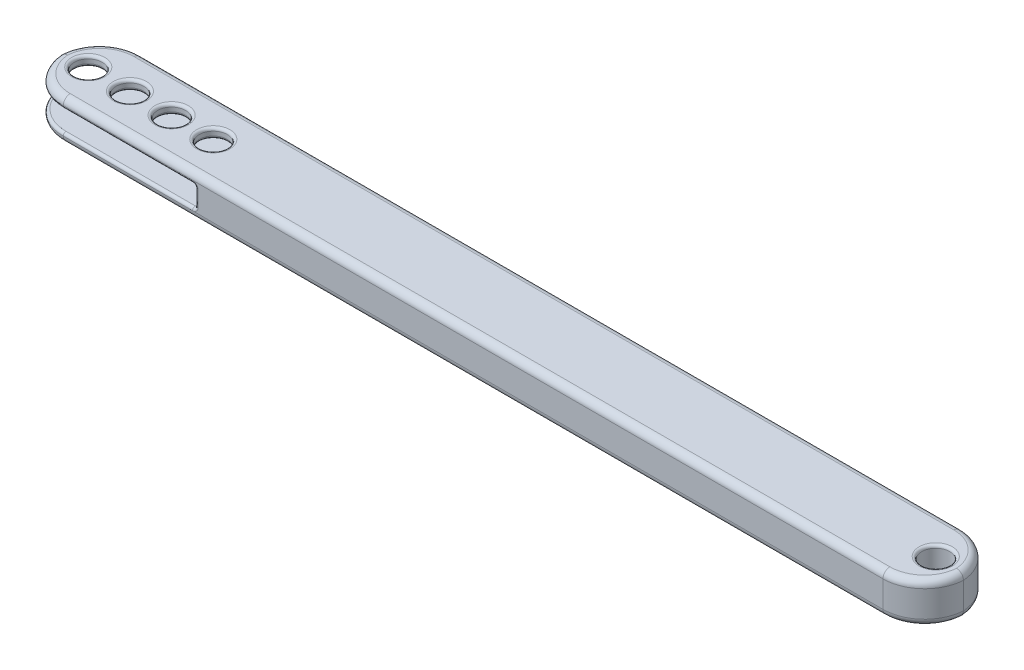
from build123d import *

# Parameters (mm, degrees)
SKETCH1_W           = 130
SKETCH1_H           = 11.2
BOSS_EXTRUDE1_DEPTH = 5.8
SKETCH2_R           = 2
CUT_EXTRUDE1_DEPTH  = 131.610413061
FILLET1_R           = 6
FILLET2_R           = 1
SKETCH3_W           = 25
SKETCH3_H           = 3
CUT_EXTRUDE2_DEPTH  = 131.597127382
FILLET3_R           = 0.4


with BuildPart() as part:
    # Sketch1 → Boss-Extrude1 (new body)
    with BuildSketch(Plane(origin=(0, 0, 0), x_dir=(1, 0, 0), z_dir=(0, 1, 0))):
        with Locations((65, 5.6)):
            Rectangle(SKETCH1_W, SKETCH1_H)
    extrude(amount=BOSS_EXTRUDE1_DEPTH)

    # Sketch2 → Cut-Extrude1 (cut, through all)
    with BuildSketch(Plane(origin=(0, 5.8, 0), x_dir=(1, 0, 0), z_dir=(0, 1, 0))):
        with Locations(Location((4, 5.6, 0), (0, 0, 270))):
            Circle(SKETCH2_R)
        with Locations(Location((126, 5.6, 0), (0, 0, 270))):
            Circle(SKETCH2_R)
        with Locations(Location((10, 5.6, 0), (0, 0, 270))):
            Circle(SKETCH2_R)
        with Locations(Location((16, 5.6, 0), (0, 0, 270))):
            Circle(SKETCH2_R)
        with Locations(Location((22, 5.6, 0), (0, 0, 270))):
            Circle(SKETCH2_R)
    extrude(amount=-CUT_EXTRUDE1_DEPTH, mode=Mode.SUBTRACT)

    # Fillet1
    # the kernel refuses this fillet: 6 mm, written as the material it takes off along each edge
    with BuildSketch(Plane(origin=(130, -15, 0), x_dir=(-1, 0, 0), z_dir=(0, 1, 0)), Plane(origin=(130, -15, -11.2), x_dir=(0, 0, 1), z_dir=(0, 1, 0))) as fillet1_piece_1:
        with BuildLine():
            CenterArc((FILLET1_R, -FILLET1_R), FILLET1_R, 90, 90)
            Line((0, -FILLET1_R), (0, 0))
            Line((0, 0), (FILLET1_R, 0))
        make_face()
    extrude(amount=35.8, mode=Mode.SUBTRACT)
    with BuildSketch(Plane(origin=(0, -15, -11.2), x_dir=(0, 0, 1), z_dir=(0, 1, 0)), Plane(origin=(0, -15, 0), x_dir=(1, 0, 0), z_dir=(0, 1, 0))) as fillet1_piece_2:
        with BuildLine():
            CenterArc((FILLET1_R, FILLET1_R), FILLET1_R, 180, 90)
            Line((0, FILLET1_R), (0, 0))
            Line((0, 0), (FILLET1_R, 0))
        make_face()
    extrude(amount=35.8, mode=Mode.SUBTRACT)

    # Fillet2
    # the kernel refuses this fillet: 1 mm, written as the material it takes off along each edge
    with BuildSketch(Plane(origin=(124, 0, -11.2), x_dir=(0, 0, 1), z_dir=(-1, 0, 0)), Plane(origin=(6, 5.8, 0), x_dir=(0, -1, 0), z_dir=(1, 0, 0))) as fillet2_piece_1:
        with BuildLine():
            CenterArc((FILLET2_R, FILLET2_R), FILLET2_R, 180, 90)
            Line((0, FILLET2_R), (0, 0))
            Line((0, 0), (FILLET2_R, 0))
        make_face()
    extrude(amount=118, mode=Mode.SUBTRACT)
    with BuildSketch(Plane(origin=(6, 0, 0), x_dir=(0, 1, 0), z_dir=(1, 0, 0)), Plane(origin=(124, 5.8, -11.2), x_dir=(0, 0, 1), z_dir=(-1, 0, 0))) as fillet2_piece_2:
        with BuildLine():
            CenterArc((FILLET2_R, -FILLET2_R), FILLET2_R, 90, 90)
            Line((0, -FILLET2_R), (0, 0))
            Line((0, 0), (FILLET2_R, 0))
        make_face()
    extrude(amount=118, mode=Mode.SUBTRACT)
    with BuildSketch(Plane(origin=(124, 0, -5.2), x_dir=(0, 0, -1), z_dir=(-1, 0, 0))) as fillet2_piece_3:
        with BuildLine():
            CenterArc((6 - FILLET2_R, -FILLET2_R), FILLET2_R, 0, 90)
            Line((6, -FILLET2_R), (6, 0))
            Line((6, 0), (6 - FILLET2_R, 0))
        make_face()
    revolve(axis=Axis((124, 0, -5.2), (0, -1, 0)), revolution_arc=110.05948027, mode=Mode.SUBTRACT)
    with BuildSketch(Plane(origin=(124, 0, -6), x_dir=(0.9393370543039211, 0, -0.3429954787043592), z_dir=(-0.3429954787043592, 0, -0.9393370543039211))) as fillet2_piece_4:
        with BuildLine():
            CenterArc((6 - FILLET2_R, -FILLET2_R), FILLET2_R, 0, 90)
            Line((6, -FILLET2_R), (6, 0))
            Line((6, 0), (6 - FILLET2_R, 0))
        make_face()
    revolve(axis=Axis((124, 0, -6), (0, -1, 0)), revolution_arc=110.05948027, mode=Mode.SUBTRACT)
    with BuildSketch(Plane(origin=(6, 0, -6), x_dir=(0, 0, 1), z_dir=(1, 0, 0))) as fillet2_piece_5:
        with BuildLine():
            CenterArc((6 - FILLET2_R, -FILLET2_R), FILLET2_R, 0, 90)
            Line((6, -FILLET2_R), (6, 0))
            Line((6, 0), (6 - FILLET2_R, 0))
        make_face()
    revolve(axis=Axis((6, 0, -6), (0, -1, 0)), revolution_arc=110.05948027, mode=Mode.SUBTRACT)
    with BuildSketch(Plane(origin=(6, 0, -5.2), x_dir=(-0.9393370543039198, 0, 0.3429954787043625), z_dir=(0.3429954787043625, 0, 0.9393370543039198))) as fillet2_piece_6:
        with BuildLine():
            CenterArc((6 - FILLET2_R, -FILLET2_R), FILLET2_R, 0, 90)
            Line((6, -FILLET2_R), (6, 0))
            Line((6, 0), (6 - FILLET2_R, 0))
        make_face()
    revolve(axis=Axis((6, 0, -5.2), (0, -1, 0)), revolution_arc=110.05948027, mode=Mode.SUBTRACT)
    with BuildSketch(Plane(origin=(124, 5.8, -5.2), x_dir=(0, 0, -1), z_dir=(-1, 0, 0))) as fillet2_piece_7:
        with BuildLine():
            CenterArc((6 - FILLET2_R, FILLET2_R), FILLET2_R, 270, 90)
            Line((6, FILLET2_R), (6, 0))
            Line((6, 0), (6 - FILLET2_R, 0))
        make_face()
    revolve(axis=Axis((124, 5.8, -5.2), (0, -1, 0)), revolution_arc=110.05948027, mode=Mode.SUBTRACT)
    with BuildSketch(Plane(origin=(124, 5.8, -6), x_dir=(0.9393370543039211, 0, -0.3429954787043592), z_dir=(-0.3429954787043592, 0, -0.9393370543039211))) as fillet2_piece_8:
        with BuildLine():
            CenterArc((6 - FILLET2_R, FILLET2_R), FILLET2_R, 270, 90)
            Line((6 - FILLET2_R, 0), (6, 0))
            Line((6, 0), (6, FILLET2_R))
        make_face()
    revolve(axis=Axis((124, 5.8, -6), (0, -1, 0)), revolution_arc=110.05948027, mode=Mode.SUBTRACT)
    with BuildSketch(Plane(origin=(6, 5.8, -6), x_dir=(0, 0, 1), z_dir=(1, 0, 0))) as fillet2_piece_9:
        with BuildLine():
            CenterArc((6 - FILLET2_R, FILLET2_R), FILLET2_R, 270, 90)
            Line((6, FILLET2_R), (6, 0))
            Line((6, 0), (6 - FILLET2_R, 0))
        make_face()
    revolve(axis=Axis((6, 5.8, -6), (0, -1, 0)), revolution_arc=110.05948027, mode=Mode.SUBTRACT)
    with BuildSketch(Plane(origin=(6, 5.8, -5.2), x_dir=(-0.9393370543039198, 0, 0.3429954787043625), z_dir=(0.3429954787043625, 0, 0.9393370543039198))) as fillet2_piece_10:
        with BuildLine():
            CenterArc((6 - FILLET2_R, FILLET2_R), FILLET2_R, 270, 90)
            Line((6, FILLET2_R), (6, 0))
            Line((6, 0), (6 - FILLET2_R, 0))
        make_face()
    revolve(axis=Axis((6, 5.8, -5.2), (0, -1, 0)), revolution_arc=110.05948027, mode=Mode.SUBTRACT)

    # Sketch3 → Cut-Extrude2 (cut, through all)
    with BuildSketch(Plane(origin=(0, 0, -11.2), x_dir=(-1, 0, 0), z_dir=(0, 0, -1))):
        with Locations((-12.513348181, 2.9)):
            Rectangle(SKETCH3_W, SKETCH3_H)
    extrude(amount=-CUT_EXTRUDE2_DEPTH, mode=Mode.SUBTRACT)

    # Fillet3
    # the kernel refuses this fillet: 0.4 mm, written as the material it adds along each edge
    with BuildSketch(Plane(origin=(25.013348181, 4.4, -11.2), x_dir=(-1, 0, 0), z_dir=(0, 0, 1)), Plane(origin=(25.013348181, 1.4, -11.2), x_dir=(0, 1, 0), z_dir=(0, 0, 1))) as fillet3_piece_1:
        with BuildLine():
            CenterArc((FILLET3_R, FILLET3_R), FILLET3_R, 180, 90)
            Line((0, FILLET3_R), (0, 0))
            Line((0, 0), (FILLET3_R, 0))
        make_face()
    extrude(amount=11.2)
    # the kernel refuses this fillet: 0.4 mm, written as the material it takes off along each edge
    with BuildSketch(Plane(origin=(126, 5.8, -5.6), x_dir=(0, 0, 1), z_dir=(-1, 0, 0))) as fillet3_2_piece_1:
        with BuildLine():
            CenterArc((2 + FILLET3_R, -FILLET3_R), FILLET3_R, 90, 90)
            Line((2, -FILLET3_R), (2, 0))
            Line((2, 0), (2 + FILLET3_R, 0))
        make_face()
    revolve(axis=Axis((126, 5.8, -5.6), (0, 1, 0)), mode=Mode.SUBTRACT)
    with BuildSketch(Plane(origin=(126, 0, -5.6), x_dir=(0, 0, 1), z_dir=(-1, 0, 0))) as fillet3_2_piece_2:
        with BuildLine():
            CenterArc((2 + FILLET3_R, FILLET3_R), FILLET3_R, 180, 90)
            Line((2, FILLET3_R), (2, 0))
            Line((2, 0), (2 + FILLET3_R, 0))
        make_face()
    revolve(axis=Axis((126, 0, -5.6), (0, 1, 0)), mode=Mode.SUBTRACT)
    with BuildSketch(Plane(origin=(4, 5.8, -5.6), x_dir=(0, 0, 1), z_dir=(-1, 0, 0))) as fillet3_2_piece_3:
        with BuildLine():
            CenterArc((2 + FILLET3_R, -FILLET3_R), FILLET3_R, 90, 90)
            Line((2, -FILLET3_R), (2, 0))
            Line((2, 0), (2 + FILLET3_R, 0))
        make_face()
    revolve(axis=Axis((4, 5.8, -5.6), (0, 1, 0)), mode=Mode.SUBTRACT)
    with BuildSketch(Plane(origin=(4, 4.4, -5.6), x_dir=(0, 0, 1), z_dir=(-1, 0, 0))) as fillet3_2_piece_4:
        with BuildLine():
            CenterArc((2 + FILLET3_R, FILLET3_R), FILLET3_R, 180, 90)
            Line((2, FILLET3_R), (2, 0))
            Line((2, 0), (2 + FILLET3_R, 0))
        make_face()
    revolve(axis=Axis((4, 4.4, -5.6), (0, 1, 0)), mode=Mode.SUBTRACT)
    with BuildSketch(Plane(origin=(4, 0, -5.6), x_dir=(0, 0, 1), z_dir=(-1, 0, 0))) as fillet3_2_piece_5:
        with BuildLine():
            CenterArc((2 + FILLET3_R, FILLET3_R), FILLET3_R, 180, 90)
            Line((2, FILLET3_R), (2, 0))
            Line((2, 0), (2 + FILLET3_R, 0))
        make_face()
    revolve(axis=Axis((4, 0, -5.6), (0, 1, 0)), mode=Mode.SUBTRACT)
    with BuildSketch(Plane(origin=(4, 1.4, -5.6), x_dir=(0, 0, 1), z_dir=(-1, 0, 0))) as fillet3_2_piece_6:
        with BuildLine():
            CenterArc((2 + FILLET3_R, -FILLET3_R), FILLET3_R, 90, 90)
            Line((2, -FILLET3_R), (2, 0))
            Line((2, 0), (2 + FILLET3_R, 0))
        make_face()
    revolve(axis=Axis((4, 1.4, -5.6), (0, 1, 0)), mode=Mode.SUBTRACT)
    with BuildSketch(Plane(origin=(22, 0, -5.6), x_dir=(0, 0, 1), z_dir=(-1, 0, 0))) as fillet3_2_piece_7:
        with BuildLine():
            CenterArc((2 + FILLET3_R, FILLET3_R), FILLET3_R, 180, 90)
            Line((2, FILLET3_R), (2, 0))
            Line((2, 0), (2 + FILLET3_R, 0))
        make_face()
    revolve(axis=Axis((22, 0, -5.6), (0, 1, 0)), mode=Mode.SUBTRACT)
    with BuildSketch(Plane(origin=(22, 1.4, -5.6), x_dir=(0, 0, 1), z_dir=(-1, 0, 0))) as fillet3_2_piece_8:
        with BuildLine():
            CenterArc((2 + FILLET3_R, -FILLET3_R), FILLET3_R, 90, 90)
            Line((2, -FILLET3_R), (2, 0))
            Line((2, 0), (2 + FILLET3_R, 0))
        make_face()
    revolve(axis=Axis((22, 1.4, -5.6), (0, 1, 0)), mode=Mode.SUBTRACT)
    with BuildSketch(Plane(origin=(22, 5.8, -5.6), x_dir=(0, 0, 1), z_dir=(-1, 0, 0))) as fillet3_2_piece_9:
        with BuildLine():
            CenterArc((2 + FILLET3_R, -FILLET3_R), FILLET3_R, 90, 90)
            Line((2, -FILLET3_R), (2, 0))
            Line((2, 0), (2 + FILLET3_R, 0))
        make_face()
    revolve(axis=Axis((22, 5.8, -5.6), (0, 1, 0)), mode=Mode.SUBTRACT)
    with BuildSketch(Plane(origin=(22, 4.4, -5.6), x_dir=(0, 0, 1), z_dir=(-1, 0, 0))) as fillet3_2_piece_10:
        with BuildLine():
            CenterArc((2 + FILLET3_R, FILLET3_R), FILLET3_R, 180, 90)
            Line((2, FILLET3_R), (2, 0))
            Line((2, 0), (2 + FILLET3_R, 0))
        make_face()
    revolve(axis=Axis((22, 4.4, -5.6), (0, 1, 0)), mode=Mode.SUBTRACT)
    with BuildSketch(Plane(origin=(16, 0, -5.6), x_dir=(0, 0, 1), z_dir=(-1, 0, 0))) as fillet3_2_piece_11:
        with BuildLine():
            CenterArc((2 + FILLET3_R, FILLET3_R), FILLET3_R, 180, 90)
            Line((2, FILLET3_R), (2, 0))
            Line((2, 0), (2 + FILLET3_R, 0))
        make_face()
    revolve(axis=Axis((16, 0, -5.6), (0, 1, 0)), mode=Mode.SUBTRACT)
    with BuildSketch(Plane(origin=(16, 1.4, -5.6), x_dir=(0, 0, 1), z_dir=(-1, 0, 0))) as fillet3_2_piece_12:
        with BuildLine():
            CenterArc((2 + FILLET3_R, -FILLET3_R), FILLET3_R, 90, 90)
            Line((2, -FILLET3_R), (2, 0))
            Line((2, 0), (2 + FILLET3_R, 0))
        make_face()
    revolve(axis=Axis((16, 1.4, -5.6), (0, 1, 0)), mode=Mode.SUBTRACT)
    with BuildSketch(Plane(origin=(16, 5.8, -5.6), x_dir=(0, 0, 1), z_dir=(-1, 0, 0))) as fillet3_2_piece_13:
        with BuildLine():
            CenterArc((2 + FILLET3_R, -FILLET3_R), FILLET3_R, 90, 90)
            Line((2, -FILLET3_R), (2, 0))
            Line((2, 0), (2 + FILLET3_R, 0))
        make_face()
    revolve(axis=Axis((16, 5.8, -5.6), (0, 1, 0)), mode=Mode.SUBTRACT)
    with BuildSketch(Plane(origin=(16, 4.4, -5.6), x_dir=(0, 0, 1), z_dir=(-1, 0, 0))) as fillet3_2_piece_14:
        with BuildLine():
            CenterArc((2 + FILLET3_R, FILLET3_R), FILLET3_R, 180, 90)
            Line((2, FILLET3_R), (2, 0))
            Line((2, 0), (2 + FILLET3_R, 0))
        make_face()
    revolve(axis=Axis((16, 4.4, -5.6), (0, 1, 0)), mode=Mode.SUBTRACT)
    with BuildSketch(Plane(origin=(10, 0, -5.6), x_dir=(0, 0, 1), z_dir=(-1, 0, 0))) as fillet3_2_piece_15:
        with BuildLine():
            CenterArc((2 + FILLET3_R, FILLET3_R), FILLET3_R, 180, 90)
            Line((2, FILLET3_R), (2, 0))
            Line((2, 0), (2 + FILLET3_R, 0))
        make_face()
    revolve(axis=Axis((10, 0, -5.6), (0, 1, 0)), mode=Mode.SUBTRACT)
    with BuildSketch(Plane(origin=(10, 1.4, -5.6), x_dir=(0, 0, 1), z_dir=(-1, 0, 0))) as fillet3_2_piece_16:
        with BuildLine():
            CenterArc((2 + FILLET3_R, -FILLET3_R), FILLET3_R, 90, 90)
            Line((2, -FILLET3_R), (2, 0))
            Line((2, 0), (2 + FILLET3_R, 0))
        make_face()
    revolve(axis=Axis((10, 1.4, -5.6), (0, 1, 0)), mode=Mode.SUBTRACT)
    with BuildSketch(Plane(origin=(10, 5.8, -5.6), x_dir=(0, 0, 1), z_dir=(-1, 0, 0))) as fillet3_2_piece_17:
        with BuildLine():
            CenterArc((2 + FILLET3_R, -FILLET3_R), FILLET3_R, 90, 90)
            Line((2, -FILLET3_R), (2, 0))
            Line((2, 0), (2 + FILLET3_R, 0))
        make_face()
    revolve(axis=Axis((10, 5.8, -5.6), (0, 1, 0)), mode=Mode.SUBTRACT)
    with BuildSketch(Plane(origin=(10, 4.4, -5.6), x_dir=(0, 0, 1), z_dir=(-1, 0, 0))) as fillet3_2_piece_18:
        with BuildLine():
            CenterArc((2 + FILLET3_R, FILLET3_R), FILLET3_R, 180, 90)
            Line((2, FILLET3_R), (2, 0))
            Line((2, 0), (2 + FILLET3_R, 0))
        make_face()
    revolve(axis=Axis((10, 4.4, -5.6), (0, 1, 0)), mode=Mode.SUBTRACT)
    # the kernel refuses this fillet: 0.4 mm, written as the material it takes off along each edge
    with BuildSketch(Plane(origin=(6, 4.4, -6), x_dir=(0, 0, 1), z_dir=(1, 0, 0))) as fillet3_3_piece_1:
        with BuildLine():
            CenterArc((6 - FILLET3_R, -FILLET3_R), FILLET3_R, 0, 90)
            Line((6, -FILLET3_R), (6, 0))
            Line((6, 0), (6 - FILLET3_R, 0))
        make_face()
    revolve(axis=Axis((6, 4.4, -6), (0, -1, 0)), revolution_arc=95.73025987, mode=Mode.SUBTRACT)
    with BuildSketch(Plane(origin=(6, 4.4, -5.2), x_dir=(-0.9950029770170926, 0, 0.09984525891159218), z_dir=(0.09984525891159218, 0, 0.9950029770170926))) as fillet3_3_piece_2:
        with BuildLine():
            CenterArc((6 - FILLET3_R, -FILLET3_R), FILLET3_R, 360, 90)
            Line((6, -FILLET3_R), (6, 0))
            Line((6, 0), (6 - FILLET3_R, 0))
        make_face()
    revolve(axis=Axis((6, 4.4, -5.2), (0, -1, 0)), revolution_arc=95.73025987, mode=Mode.SUBTRACT)
    with BuildSketch(Plane(origin=(6, 1.4, -6), x_dir=(0, 0, 1), z_dir=(1, 0, 0))) as fillet3_3_piece_3:
        with BuildLine():
            CenterArc((6 - FILLET3_R, FILLET3_R), FILLET3_R, 270, 90)
            Line((6 - FILLET3_R, 0), (6, 0))
            Line((6, 0), (6, FILLET3_R))
        make_face()
    revolve(axis=Axis((6, 1.4, -6), (0, -1, 0)), revolution_arc=95.73025987, mode=Mode.SUBTRACT)
    with BuildSketch(Plane(origin=(6, 1.4, -5.2), x_dir=(-0.9950029770170926, 0, 0.0998452589115928), z_dir=(0.0998452589115928, 0, 0.9950029770170926))) as fillet3_3_piece_4:
        with BuildLine():
            CenterArc((6 - FILLET3_R, FILLET3_R), FILLET3_R, 270, 90)
            Line((6, FILLET3_R), (6, 0))
            Line((6, 0), (6 - FILLET3_R, 0))
        make_face()
    revolve(axis=Axis((6, 1.4, -5.2), (0, -1, 0)), revolution_arc=95.73025987, mode=Mode.SUBTRACT)
    with BuildSketch(Plane(origin=(24.613348181, 4.4, 0), x_dir=(0, 1, 0), z_dir=(-1, 0, 0)), Plane(origin=(24.613348181, 4.4, -11.2), x_dir=(0, 0, 1), z_dir=(-1, 0, 0)), Plane(origin=(6, 1.4, 0), x_dir=(0, -1, 0), z_dir=(1, 0, 0)), Plane(origin=(6, 1.4, -11.2), x_dir=(0, 0, 1), z_dir=(1, 0, 0))) as fillet3_3_piece_5:
        with BuildLine():
            CenterArc((FILLET3_R, FILLET3_R), FILLET3_R, 180, 90)
            Line((0, FILLET3_R), (0, 0))
            Line((0, 0), (FILLET3_R, 0))
        make_face()
    extrude(amount=18.613348181, mode=Mode.SUBTRACT)
    with BuildSketch(Plane(origin=(25.013348181, 1.8, 0), x_dir=(1, 0, 0), z_dir=(0, 1, 0)), Plane(origin=(25.013348181, 1.8, -11.2), x_dir=(0, 0, 1), z_dir=(0, 1, 0))) as fillet3_3_piece_6:
        with BuildLine():
            CenterArc((FILLET3_R, FILLET3_R), FILLET3_R, 180, 90)
            Line((0, FILLET3_R), (0, 0))
            Line((0, 0), (FILLET3_R, 0))
        make_face()
    extrude(amount=2.2, mode=Mode.SUBTRACT)
    with BuildSketch(Plane(origin=(24.613348181, 1.8, -11.2), x_dir=(1, 0, 0), z_dir=(0, 1, 0))) as fillet3_3_piece_7:
        with BuildLine():
            CenterArc((0.4 + FILLET3_R, -FILLET3_R), FILLET3_R, 90, 90)
            Line((0.4 + FILLET3_R, 0), (0.4, 0))
            Line((0.4, 0), (0.4, -FILLET3_R))
        make_face()
    revolve(axis=Axis((24.613348181, 1.8, -11.2), (0, 0, -1)), revolution_arc=90, mode=Mode.SUBTRACT)
    with BuildSketch(Plane(origin=(24.613348181, 4, -11.2), x_dir=(0, 1, 0), z_dir=(-1, 0, 0))) as fillet3_3_piece_8:
        with BuildLine():
            CenterArc((0.4 + FILLET3_R, -FILLET3_R), FILLET3_R, 90, 90)
            Line((0.4 + FILLET3_R, 0), (0.4, 0))
            Line((0.4, 0), (0.4, -FILLET3_R))
        make_face()
    revolve(axis=Axis((24.613348181, 4, -11.2), (0, 0, -1)), revolution_arc=90, mode=Mode.SUBTRACT)
    with BuildSketch(Plane(origin=(24.613348181, 1.8, 0), x_dir=(1, 0, 0), z_dir=(0, 1, 0))) as fillet3_3_piece_9:
        with BuildLine():
            CenterArc((0.4 + FILLET3_R, FILLET3_R), FILLET3_R, 180, 90)
            Line((0.4, FILLET3_R), (0.4, 0))
            Line((0.4, 0), (0.4 + FILLET3_R, 0))
        make_face()
    revolve(axis=Axis((24.613348181, 1.8, 0), (0, 0, -1)), revolution_arc=90, mode=Mode.SUBTRACT)
    with BuildSketch(Plane(origin=(24.613348181, 4, 0), x_dir=(0, 1, 0), z_dir=(-1, 0, 0))) as fillet3_3_piece_10:
        with BuildLine():
            CenterArc((0.4 + FILLET3_R, FILLET3_R), FILLET3_R, 180, 90)
            Line((0.4, FILLET3_R), (0.4, 0))
            Line((0.4, 0), (0.4 + FILLET3_R, 0))
        make_face()
    revolve(axis=Axis((24.613348181, 4, 0), (0, 0, -1)), revolution_arc=90, mode=Mode.SUBTRACT)


solid = part.part
